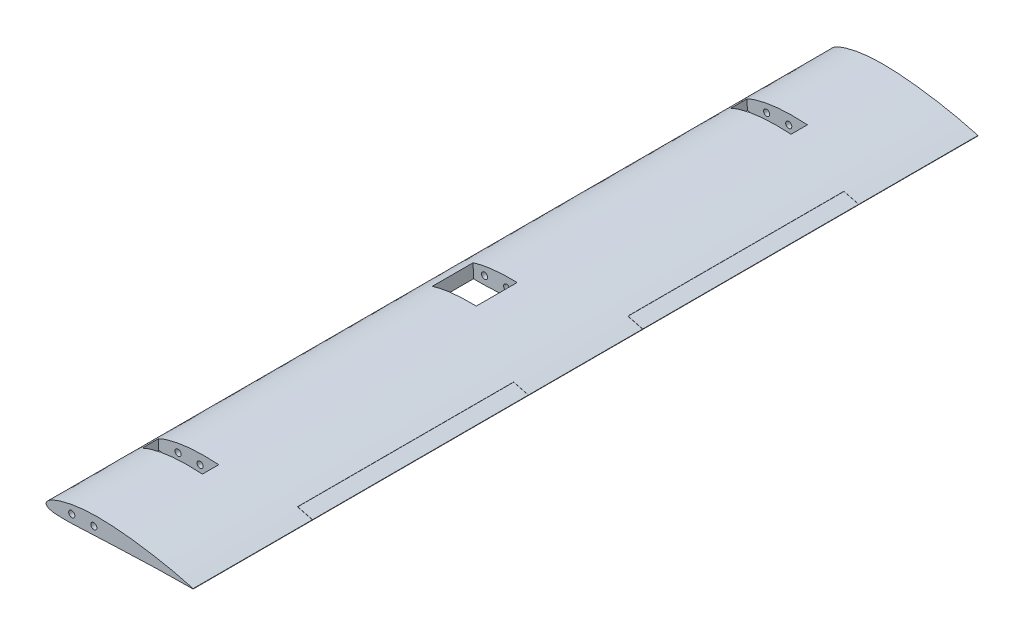
from build123d import *

# Parameters (mm, degrees)
SKETCH2_R               = 4.7625
EXTRUDE_AIRFOIL_DEPTH   = 1219.2
AILERONS_DEPTH          = 1241.930446903
AILERONS_DEPTH_BACK     = 1241.930446903
SKETCH3_W               = 23.368
SKETCH3_H               = 335.788
SKETCH3_W_2             = 22.86
SKETCH3_H_2             = 335.28
CUT_EXTRUDE1_DEPTH      = 1241.650515326
CUT_EXTRUDE1_DEPTH_BACK = 1241.650515326
SKETCH5_W               = 25.4
SKETCH5_H               = 93.98
SKETCH5_W_2             = 63.5
SKETCH5_H_2             = 68.58


with BuildPart() as part:
    # Sketch2 → Extrude airfoil (new body)
    with BuildSketch(Plane.XY):
        with BuildLine():
            Line((228.6, 11.792831891), (228.6, 12.387025086))
            add(Edge.make_bspline(
                [(228.6, 12.387025086), (224.79499634, 13.422833003), (217.203351463, 15.489450166), (201.995086366, 19.24706995), (182.976626701, 23.398782778), (160.101034919, 27.491378445), (137.243176809, 30.846032277), (114.372582505, 33.23890504), (91.503980941, 34.73131665), (72.412997667, 34.746410141), (57.169927463, 33.691843848), (45.722178876, 32.302790192), (34.249688597, 30.254339076), (24.742840243, 27.790786051), (17.124502123, 25.302700119), (11.38009907, 22.953832003), (6.478661385, 20.413593164), (2.224209454, 17.375019555), (-1.479318567, 12.488031674), (2.518152586, 8.750563835), (6.597176672, 7.283468722), (11.455013829, 6.293244116), (17.192107473, 5.789786203), (24.819037957, 5.433479126), (34.346917188, 5.460166768), (45.776283997, 5.77999863), (57.197586321, 6.388979964), (72.433369023, 7.101546318), (91.474845089, 8.015960902), (114.332736884, 8.874603332), (137.183285679, 9.828052553), (160.036020936, 10.640146808), (182.890586988, 11.237493082), (201.936912913, 11.54078297), (217.172860417, 11.740515028), (224.791022029, 11.77539325), (228.6, 11.792831891)],
                knots=[0, 0, 0, 0, 0.025304886, 0.050487653, 0.100520433, 0.150190716, 0.199586607, 0.248740009, 0.297715539, 0.346600594, 0.371102737, 0.395726297, 0.420570145, 0.445825119, 0.458702216, 0.471919982, 0.485786003, 0.493461051, 0.506863029, 0.51614777, 0.522766003, 0.535269014, 0.547551134, 0.559786371, 0.584228898, 0.60868081, 0.633151284, 0.657621757, 0.706558114, 0.75548187, 0.804405627, 0.853320224, 0.902221408, 0.951113136, 0.975557228, 1, 1, 1, 1], degree=3))
        make_face()
        with Locations((40.005, 18.43992729)):
            Circle(SKETCH2_R, mode=Mode.SUBTRACT)
        with Locations((74.283249673, 19.337534848)):
            Circle(SKETCH2_R, mode=Mode.SUBTRACT)
    extrude(amount=EXTRUDE_AIRFOIL_DEPTH)

    # Sketch3 → Ailerons (cut, two sides: drawn at the far end of the back side and taken through both)
    # profile 1 of 2: a face of its own
    with BuildSketch(Plane(origin=(0, 0, 0), x_dir=(1, 0, 0), z_dir=(0, 1, 0)).offset(-AILERONS_DEPTH_BACK)):
        with Locations((217.17, -353.06)):
            Rectangle(SKETCH3_W, SKETCH3_H)
        with Locations((217.17, -353.06)):
            Rectangle(SKETCH3_W_2, SKETCH3_H_2, mode=Mode.SUBTRACT)
    # profile 2 of 2: a face of its own
    with BuildSketch(Plane(origin=(0, 0, 0), x_dir=(1, 0, 0), z_dir=(0, 1, 0)).offset(-AILERONS_DEPTH_BACK)):
        with Locations((217.17, -866.14)):
            Rectangle(SKETCH3_W, SKETCH3_H)
        with Locations((217.17, -866.14)):
            Rectangle(SKETCH3_W_2, SKETCH3_H_2, mode=Mode.SUBTRACT)
    extrude(amount=AILERONS_DEPTH + AILERONS_DEPTH_BACK, mode=Mode.SUBTRACT)


with BuildPart() as ailerons_piece_1:
    # of the separate pieces the step leaves, piece 1, a body of its own (ailerons_pieces)
    add(part.part.solids().sort_by_distance((228.6, 11.792831891, 0))[0])

    # Sketch5 → Cut-Extrude1 (cut, two sides: drawn at the far end of the back side and taken through both)
    with BuildSketch(Plane(origin=(-0.455122883, 17.380441686, 0), x_dir=(0, 0, -1), z_dir=(-0.026176948307859344, 0.9996573249755578, 0)).offset(-CUT_EXTRUDE1_DEPTH_BACK)):
        with Locations((-1066.8, -57.15)):
            Rectangle(SKETCH5_W, SKETCH5_H)
        with Locations((-152.4, -57.15)):
            Rectangle(SKETCH5_W, SKETCH5_H)
        with Locations((-609.6, -57.15)):
            Rectangle(SKETCH5_W_2, SKETCH5_H_2)
    extrude(amount=CUT_EXTRUDE1_DEPTH + CUT_EXTRUDE1_DEPTH_BACK, mode=Mode.SUBTRACT)


with BuildPart() as ailerons_piece_2:
    # of the separate pieces the step leaves, piece 2, a body of its own (ailerons_pieces)
    add(part.part.solids().sort_by_distance((228.6, 12.387025086, 185.42))[0])


with BuildPart() as ailerons_piece_3:
    # of the separate pieces the step leaves, piece 3, a body of its own (ailerons_pieces)
    add(part.part.solids().sort_by_distance((228.6, 11.792831891, 698.5))[0])


solid = Compound([ailerons_piece_1.part, ailerons_piece_2.part, ailerons_piece_3.part])
